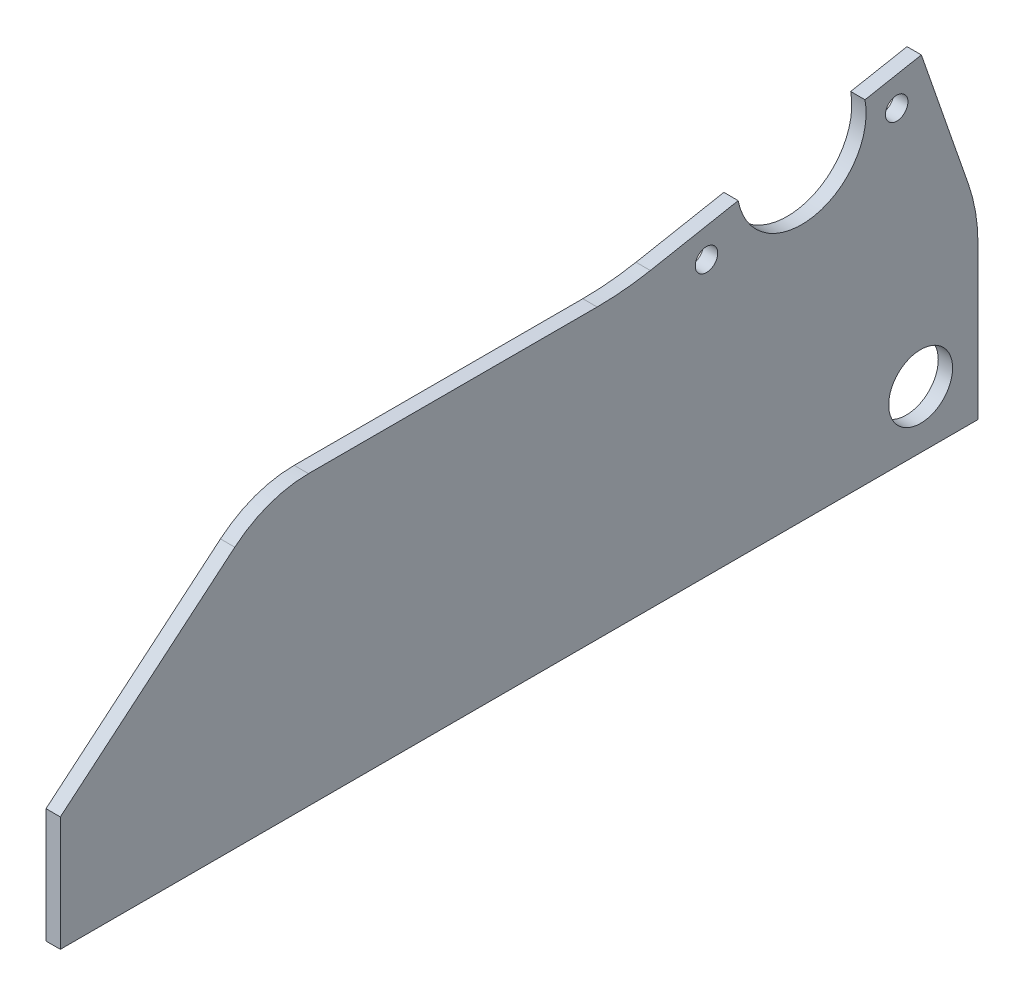
from build123d import *

# Parameters (mm, degrees)
BOSS_EXTRUDE1_DEPTH    = 3.175
F_10_CLEARANCE_HOLE1_D = 4.9784
SKETCH9_R              = 7.0739
CUT_EXTRUDE1_DEPTH     = 207.765399971
FILLET1_R              = 38.1
FILLET2_R              = 63.5


with BuildPart() as part:
    # Sketch1 → Boss-Extrude1 (new body)
    with BuildSketch(Plane(origin=(0, 0, 0), x_dir=(0, 0, -1), z_dir=(1, 0, 0))):
        with BuildLine():
            Line((0, -38.1), (0, 1.990947987))
            Line((0, 1.990947987), (-12.542971184, 38.1))
            Line((-12.542971184, 38.1), (-25.022125172, 35.741883009))
            ThreePointArc((-25.022125172, 35.741883009), (-36.408291793, 19.049953157), (-53.100221645, 30.436119779))
            Line((-53.100221645, 30.436119779), (-78.393569898, 25.656575081))
            Line((-78.393569898, 25.656575081), (-148.243569898, 25.656575081))
            ThreePointArc((-148.243569898, 25.656575081), (-156.930881538, 24.124767649), (-164.570375184, 19.714103936))
            Line((-164.570375184, 19.714103936), (-203.2, -12.7))
            Line((-203.2, -12.7), (-203.2, -38.1))
            Line((-203.2, -38.1), (0, -38.1))
        make_face()
    extrude(amount=BOSS_EXTRUDE1_DEPTH)

    # #10 Clearance Hole1 (through all)
    with Locations(Plane(origin=(3.175, 0, 0), x_dir=(0, 0, -1), z_dir=(1, 0, 0))):
        with Locations((-60.119745763, 22.647301788), (-18.002601053, 30.605946633)):
            Hole(F_10_CLEARANCE_HOLE1_D / 2)

    # Sketch9 → Cut-Extrude1 (cut, through all)
    with BuildSketch(Plane(origin=(3.175, 0, 0), x_dir=(0, 0, -1), z_dir=(1, 0, 0))):
        with Locations((-12.7, -25.4)):
            Circle(SKETCH9_R)
    extrude(amount=-CUT_EXTRUDE1_DEPTH, mode=Mode.SUBTRACT)

    # Fillet1
    fillet1_edges = [part.edges().sort_by_distance(p)[0] for p in [
        (1.5875, 1.990947987, 0),
    ]]
    fillet(fillet1_edges, radius=FILLET1_R)

    # Fillet2
    fillet2_edges = [part.edges().sort_by_distance(p)[0] for p in [
        (1.5875, 25.656575081, 78.393569898),
    ]]
    fillet(fillet2_edges, radius=FILLET2_R)


solid = part.part
